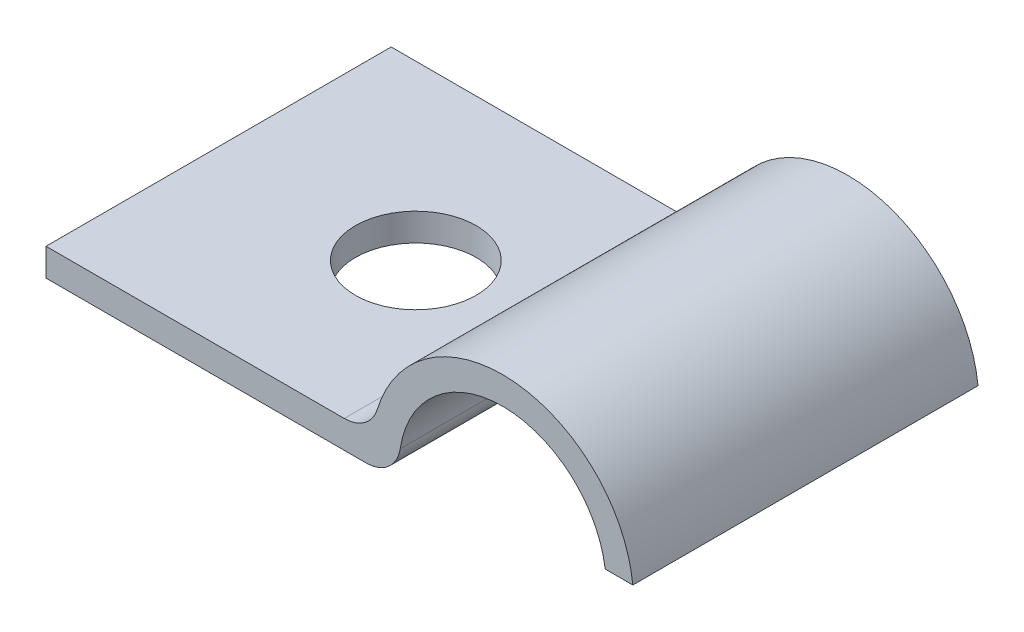
from build123d import *

# Parameters (mm, degrees)
BOSS_EXTRUDE1_DEPTH = 10
FILLET1_R           = 1
SKETCH3_R           = 1.75
CUT_EXTRUDE1_DEPTH  = 21.013037169


with BuildPart() as part:
    # Sketch2 → Boss-Extrude1 (new body)
    with BuildSketch(Plane.XY):
        with BuildLine():
            Line((0, 0), (10.253572501, 0))
            ThreePointArc((10.253572501, 0), (12.826786251, 3.373213749), (16.2, 0.8))
            Line((16.2, 0.8), (17, 0.8))
            ThreePointArc((17, 0.8), (13.226786251, 4.194356599), (9.453572501, 0.8))
            Line((9.453572501, 0.8), (0, 0.8))
            Line((0, 0.8), (0, 0))
        make_face()
    extrude(amount=BOSS_EXTRUDE1_DEPTH)

    # Fillet1
    fillet1_edges = [part.edges().sort_by_distance(p)[0] for p in [
        (9.453572501, 0.8, 5),
        (10.253572501, 0, 5),
    ]]
    fillet(fillet1_edges, radius=FILLET1_R)

    # Sketch3 → Cut-Extrude1 (cut, through all)
    with BuildSketch(Plane(origin=(0, 0.8, 0), x_dir=(1, 0, 0), z_dir=(0, 1, 0))):
        with Locations((5.713393125, -5)):
            Circle(SKETCH3_R)
    extrude(amount=-CUT_EXTRUDE1_DEPTH, mode=Mode.SUBTRACT)


solid = part.part
